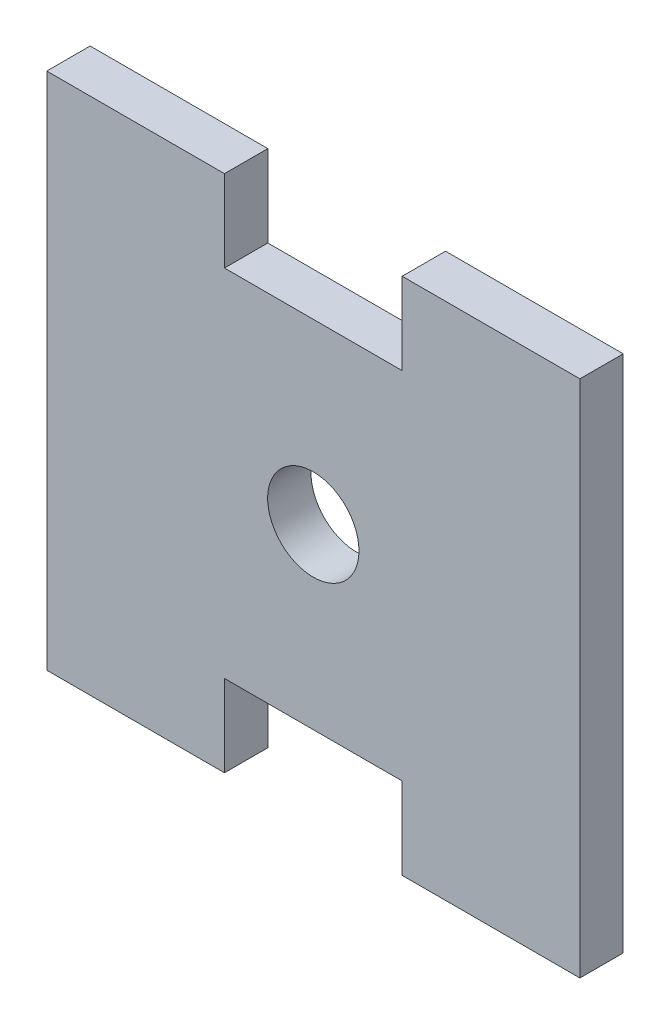
from build123d import *

# Parameters (mm, degrees)
SKETCH1_R           = 3.2631
BOSS_EXTRUDE1_DEPTH = 3.0988


with BuildPart() as part:
    # Sketch1 → Boss-Extrude1 (new body)
    with BuildSketch(Plane.XY):
        Polygon((-6.35, -18.542), (-6.35, -12.7), (6.35, -12.7), (6.35, -18.542), (19.05, -18.542), (19.05, -12.7), (19.05, 12.7), (19.05, 18.542), (6.35, 18.542), (6.35, 12.7), (-6.35, 12.7), (-6.35, 18.542), (-19.05, 18.542), (-19.05, 12.7), (-19.05, -12.7), (-19.05, -18.542), align=None)
        Circle(SKETCH1_R, mode=Mode.SUBTRACT)
    extrude(amount=BOSS_EXTRUDE1_DEPTH)


solid = part.part
